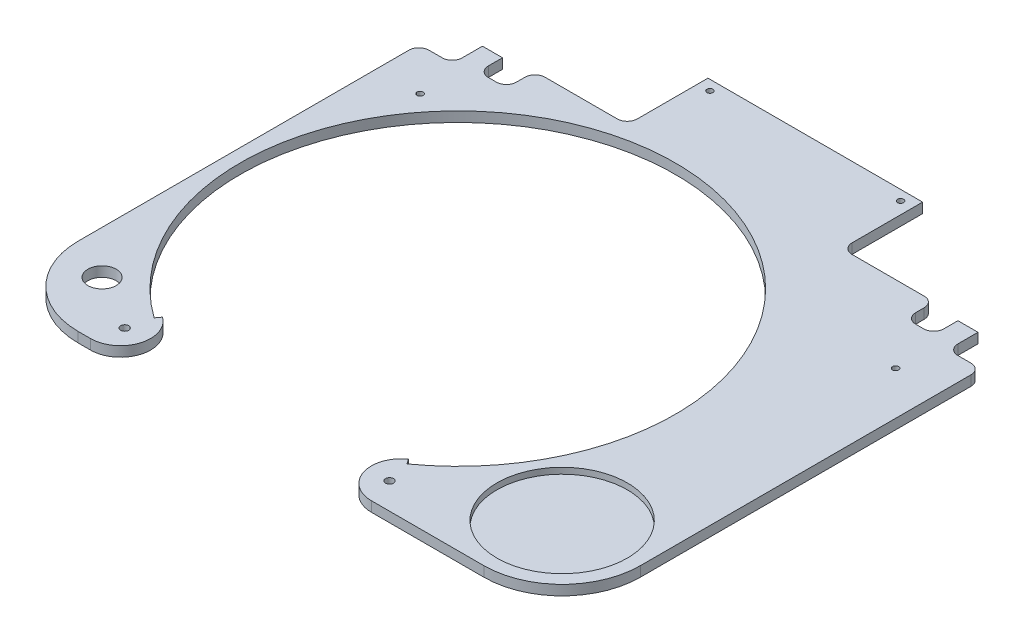
from build123d import *

# Parameters (mm, degrees)
ESQUISSE1_W              = 280.2
ESQUISSE1_H              = 276.282873123
BOSS_EXTRU_1_DEPTH       = 5
ENL_V_MAT_EXTRU_1_DEPTH  = 283.344868376
ENL_V_MAT_EXTRU_3_DEPTH  = 283.344868376
ESQUISSE5_R              = 2
ENL_V_MAT_EXTRU_4_DEPTH  = 283.344868376
ENL_V_MAT_EXTRU_5_DEPTH  = 283.344868376
ESQUISSE7_R              = 7.071067812
ENL_V_MAT_EXTRU_6_DEPTH  = 283.344868376
ESQUISSE8_R              = 1.5
ENL_V_MAT_EXTRU_8_DEPTH  = 283.344868376
ESQUISSE9_R              = 32.5
ENL_V_MAT_EXTRU_10_DEPTH = 3
ESQUISSE10_R             = 1.5
ENL_V_MAT_EXTRU_11_DEPTH = 283.344868376


with BuildPart() as part:
    # Esquisse1 → Boss.-Extru.1 (new body)
    with BuildSketch(Plane(origin=(0, 0, 0), x_dir=(1, 0, 0), z_dir=(0, 1, 0))):
        with Locations((0, -106.941436562)):
            Rectangle(ESQUISSE1_W, ESQUISSE1_H)
    extrude(amount=BOSS_EXTRU_1_DEPTH)

    # Esquisse2 → Enlèv. mat.-Extru.1 (cut, through all)
    with BuildSketch(Plane(origin=(0, 5, 0), x_dir=(1, 0, 0), z_dir=(0, 1, 0))):
        with BuildLine():
            Line((-86.286307054, -217.873386842), (-88.029045643, -220.315284098))
            ThreePointArc((-88.029045643, -220.315284098), (-128.330678708, -98.90890093), (-25, -23.5))
            ThreePointArc((-25, -23.5), (78.330678708, -98.90890093), (38.029045643, -220.315284098))
            Line((38.029045643, -220.315284098), (36.286307054, -217.873386842))
            ThreePointArc((36.286307054, -217.873386842), (30.714652713, -234.657679446), (45, -245.082873123))
            Line((45, -245.082873123), (-95, -245.082873123))
            ThreePointArc((-95, -245.082873123), (-80.714652713, -234.657679446), (-86.286307054, -217.873386842))
        make_face()
    extrude(amount=-ENL_V_MAT_EXTRU_1_DEPTH, mode=Mode.SUBTRACT)

    # Esquisse4 → Enlèv. mat.-Extru.3 (cut, through all)
    with BuildSketch(Plane(origin=(0, 5, 0), x_dir=(1, 0, 0), z_dir=(0, 1, 0))):
        with BuildLine():
            Line((140.1, -245.082873123), (101.1, -245.082873123))
            ThreePointArc((101.1, -245.082873123), (128.677164466, -233.660037589), (140.1, -206.082873123))
            Line((140.1, -206.082873123), (140.1, -245.082873123))
        make_face()
        with BuildLine():
            Line((-101.1, -245.082873123), (-140.1, -245.082873123))
            Line((-140.1, -245.082873123), (-140.1, -206.082873123))
            ThreePointArc((-140.1, -206.082873123), (-128.677164466, -233.660037589), (-101.1, -245.082873123))
        make_face()
    extrude(amount=-ENL_V_MAT_EXTRU_3_DEPTH, mode=Mode.SUBTRACT)

    # Esquisse5 → Enlèv. mat.-Extru.4 (cut, through all)
    with BuildSketch(Plane(origin=(0, 5, 0), x_dir=(1, 0, 0), z_dir=(0, 1, 0))):
        with Locations((-91, -232)):
            Circle(ESQUISSE5_R)
        with Locations((41, -232)):
            Circle(ESQUISSE5_R)
    extrude(amount=-ENL_V_MAT_EXTRU_4_DEPTH, mode=Mode.SUBTRACT)

    # Esquisse6 → Enlèv. mat.-Extru.5 (cut, through all)
    with BuildSketch(Plane(origin=(0, 5, 0), x_dir=(1, 0, 0), z_dir=(0, 1, 0))):
        with BuildLine():
            Line((140.1, 31.2), (0, 31.2))
            Line((0, 31.2), (-140.1, 31.2))
            Line((-140.1, 31.2), (-140.1, -41.25))
            ThreePointArc((-140.1, -41.25), (-138.635533906, -37.714466094), (-135.1, -36.25))
            Line((-135.1, -36.25), (-128.5, -36.25))
            ThreePointArc((-128.5, -36.25), (-124.964466094, -34.785533906), (-123.5, -31.25))
            Line((-123.5, -31.25), (-123.5, -21.2))
            Line((-123.5, -21.2), (-113.5, -21.2))
            Line((-113.5, -21.2), (-113.5, -28.25))
            ThreePointArc((-113.5, -28.25), (-112.035533906, -31.785533906), (-108.5, -33.25))
            Line((-108.5, -33.25), (-104.5, -33.25))
            ThreePointArc((-104.5, -33.25), (-100.964466094, -31.785533906), (-99.5, -28.25))
            Line((-99.5, -28.25), (-99.5, -24))
            ThreePointArc((-99.5, -24), (-98.035533906, -20.464466094), (-94.5, -19))
            Line((-94.5, -19), (-58.5, -19))
            ThreePointArc((-58.5, -19), (-54.964466094, -17.535533906), (-53.5, -14))
            Line((-53.5, -14), (-53.5, 21.2))
            Line((-53.5, 21.2), (53.5, 21.2))
            Line((53.5, 21.2), (53.5, -14))
            ThreePointArc((53.5, -14), (54.964466094, -17.535533906), (58.5, -19))
            Line((58.5, -19), (94.5, -19))
            ThreePointArc((94.5, -19), (98.035533906, -20.464466094), (99.5, -24))
            Line((99.5, -24), (99.5, -28.25))
            ThreePointArc((99.5, -28.25), (100.964466094, -31.785533906), (104.5, -33.25))
            Line((104.5, -33.25), (108.5, -33.25))
            ThreePointArc((108.5, -33.25), (112.035533906, -31.785533906), (113.5, -28.25))
            Line((113.5, -28.25), (113.5, -21.2))
            Line((113.5, -21.2), (123.5, -21.2))
            Line((123.5, -21.2), (123.5, -31.25))
            ThreePointArc((123.5, -31.25), (124.964466094, -34.785533906), (128.5, -36.25))
            Line((128.5, -36.25), (135.1, -36.25))
            ThreePointArc((135.1, -36.25), (138.635533906, -37.714466094), (140.1, -41.25))
            Line((140.1, -41.25), (140.1, 31.2))
        make_face()
    extrude(amount=-ENL_V_MAT_EXTRU_5_DEPTH, mode=Mode.SUBTRACT)

    # Esquisse7 → Enlèv. mat.-Extru.6 (cut, through all)
    with BuildSketch(Plane(origin=(0, 5, 0), x_dir=(1, 0, 0), z_dir=(0, 1, 0))):
        with Locations((-118.5, -215.8)):
            Circle(ESQUISSE7_R)
    extrude(amount=-ENL_V_MAT_EXTRU_6_DEPTH, mode=Mode.SUBTRACT)

    # Esquisse8 → Enlèv. mat.-Extru.8 (cut, through all)
    with BuildSketch(Plane.XZ):
        with Locations((47.5, -16.2)):
            Circle(ESQUISSE8_R)
        with Locations((-47.5, -16.2)):
            Circle(ESQUISSE8_R)
    extrude(amount=-ENL_V_MAT_EXTRU_8_DEPTH, mode=Mode.SUBTRACT)

    # Esquisse9 → Enlèv. mat.-Extru.10 (cut)
    with BuildSketch(Plane(origin=(0, 5, 0), x_dir=(1, 0, 0), z_dir=(0, 1, 0))):
        with Locations((101.1, -206.082873123)):
            Circle(ESQUISSE9_R)
    extrude(amount=-ENL_V_MAT_EXTRU_10_DEPTH, mode=Mode.SUBTRACT)

    # Esquisse10 → Enlèv. mat.-Extru.11 (cut, through all)
    with BuildSketch(Plane(origin=(0, 5, 0), x_dir=(1, 0, 0), z_dir=(0, 1, 0))):
        with Locations((118.5, -57.265046493)):
            Circle(ESQUISSE10_R)
        with Locations((-118.5, -57.265046493)):
            Circle(ESQUISSE10_R)
    extrude(amount=-ENL_V_MAT_EXTRU_11_DEPTH, mode=Mode.SUBTRACT)


solid = part.part
